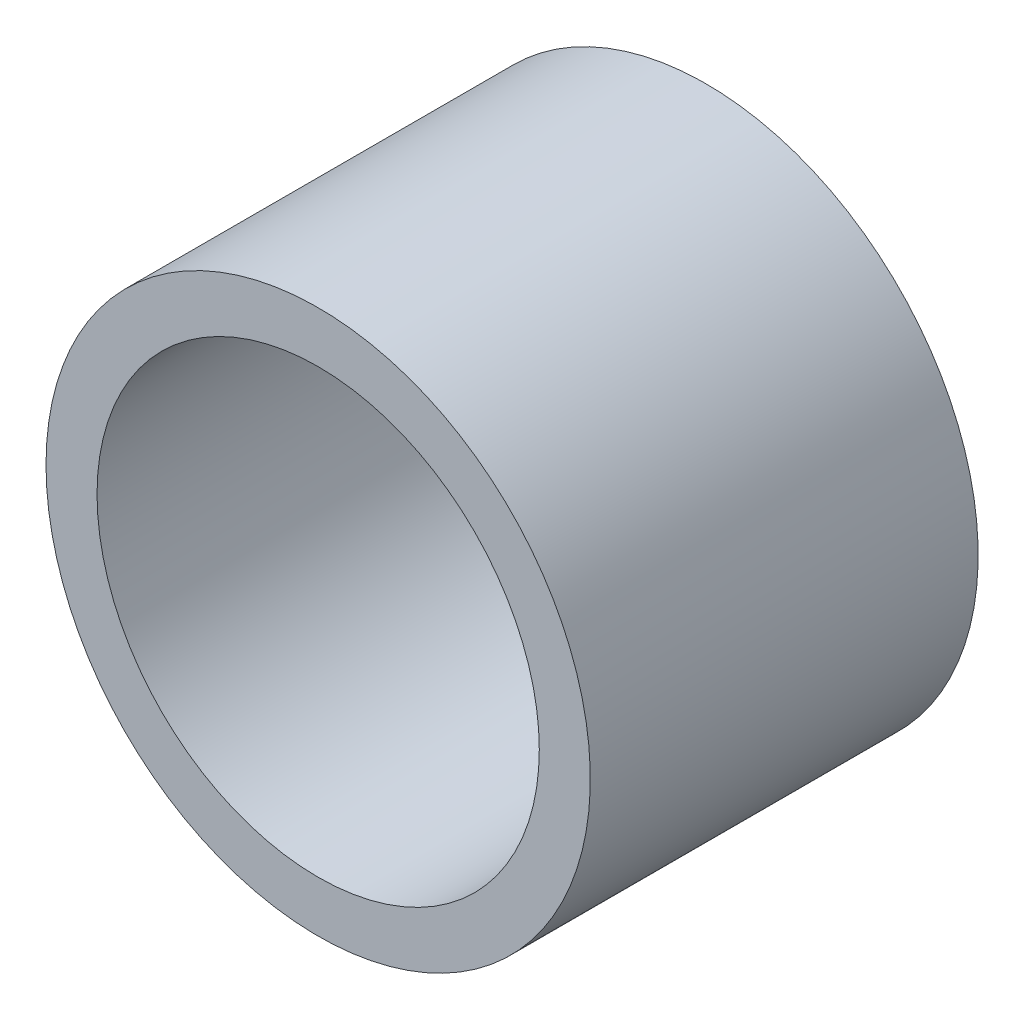
from build123d import *

# Parameters (mm, degrees)
ESQUISSE1_R        = 20
ESQUISSE1_R_2      = 16.25
BOSS_EXTRU_1_DEPTH = 28.5


with BuildPart() as part:
    # Esquisse1 → Boss.-Extru.1 (new body)
    with BuildSketch(Plane.XY):
        Circle(ESQUISSE1_R)
        Circle(ESQUISSE1_R_2, mode=Mode.SUBTRACT)
    extrude(amount=BOSS_EXTRU_1_DEPTH)


solid = part.part
